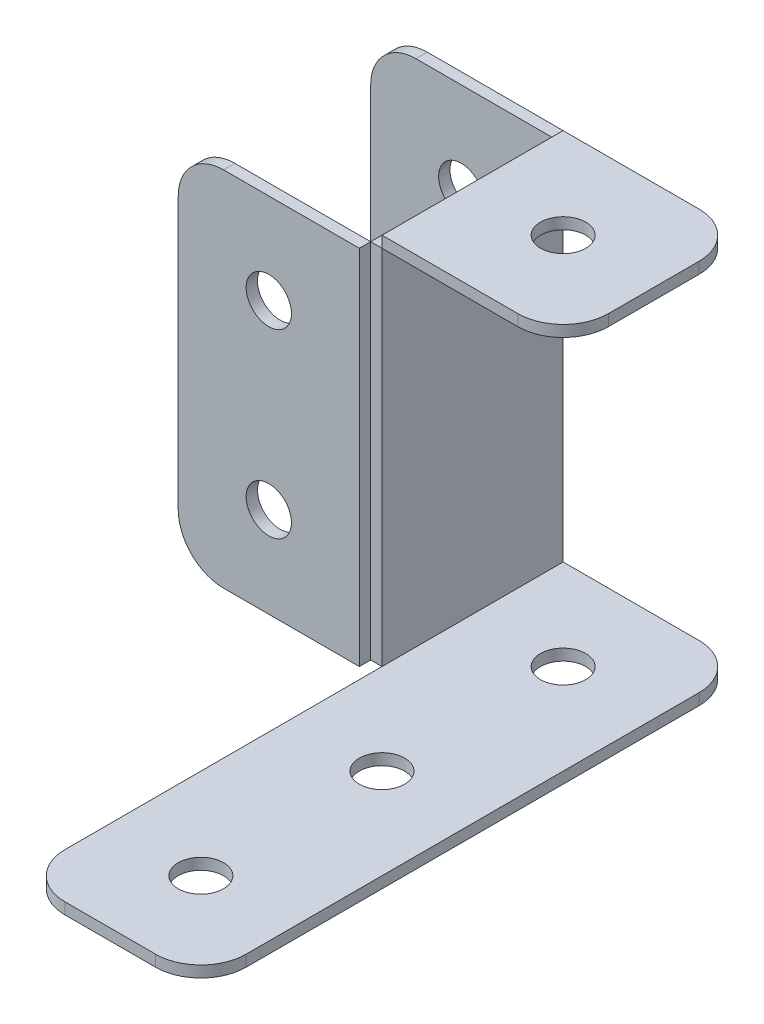
from build123d import *

# Parameters (mm, degrees)
SKETCH1_W           = 25.4
SKETCH1_H           = 50.8
SKETCH1_R           = 3.175
BOSS_EXTRUDE1_DEPTH = 1.5875
BOSS_EXTRUDE2_START = -25.4
SKETCH1_2_W         = 25.4
SKETCH1_2_H         = 50.8
SKETCH1_2_R         = 3.175
BOSS_EXTRUDE2_DEPTH = 1.5875
SKETCH3_W           = 25.4
SKETCH3_H           = 50.8
BOSS_EXTRUDE3_DEPTH = 1.5875
SKETCH4_R           = 3.175
BOSS_EXTRUDE4_DEPTH = 1.5875
SKETCH5_W           = 25.4
SKETCH5_H           = 25.4
SKETCH5_R           = 3.175
BOSS_EXTRUDE5_DEPTH = 1.5875
FILLET1_R           = 6.35
FILLET2_R           = 6.35
FILLET3_R           = 6.35
FILLET4_R           = 6.35


with BuildPart() as part:
    # Sketch1 → Boss-Extrude1 (new body)
    with BuildSketch(Plane.XY):
        with Locations((-12.7, 25.4)):
            Rectangle(SKETCH1_W, SKETCH1_H)
        with Locations((-12.7, 38.1)):
            Circle(SKETCH1_R, mode=Mode.SUBTRACT)
        with Locations((-12.7, 12.7)):
            Circle(SKETCH1_R, mode=Mode.SUBTRACT)
    extrude(amount=BOSS_EXTRUDE1_DEPTH)

    # Fillet3
    fillet3_edges = [part.edges().sort_by_distance(p)[0] for p in [
        (-25.4, 50.8, 0.79375),
        (-25.4, 0, 0.79375),
    ]]
    fillet(fillet3_edges, radius=FILLET3_R)


with BuildPart() as body_2:
    # Sketch1<2> → Boss-Extrude2 (new body)
    with BuildSketch(Plane.XY.offset(BOSS_EXTRUDE2_START)):
        with Locations((-12.7, 25.4)):
            Rectangle(SKETCH1_2_W, SKETCH1_2_H)
        with Locations((-12.7, 38.1)):
            Circle(SKETCH1_2_R, mode=Mode.SUBTRACT)
        with Locations((-12.7, 12.7)):
            Circle(SKETCH1_2_R, mode=Mode.SUBTRACT)
    extrude(amount=-BOSS_EXTRUDE2_DEPTH)

    # Fillet2
    fillet2_edges = [body_2.edges().sort_by_distance(p)[0] for p in [
        (-25.4, 0, -26.19375),
        (-25.4, 50.8, -26.19375),
    ]]
    fillet(fillet2_edges, radius=FILLET2_R)


with BuildPart() as body_3:
    # Sketch3 → Boss-Extrude3 (new body)
    with BuildSketch(Plane(origin=(0, 0, 0), x_dir=(0, 0, -1), z_dir=(1, 0, 0))):
        with Locations((12.7, 25.4)):
            Rectangle(SKETCH3_W, SKETCH3_H)
    extrude(amount=BOSS_EXTRUDE3_DEPTH)


with BuildPart() as body_4:
    # Sketch4 → Boss-Extrude4 (new body)
    with BuildSketch(Plane(origin=(0, 0, 0), x_dir=(1, 0, 0), z_dir=(0, 1, 0))):
        Polygon((1.5875, -50.8), (26.9875, -50.8), (26.9875, -25.4), (26.9875, 25.4), (1.5875, 25.4), (1.5875, 0), (1.5875, -25.4), align=None)
        with Locations((14.2875, 12.7)):
            Circle(SKETCH4_R, mode=Mode.SUBTRACT)
        with Locations((14.2875, -12.7)):
            Circle(SKETCH4_R, mode=Mode.SUBTRACT)
        with Locations((14.2875, -38.1)):
            Circle(SKETCH4_R, mode=Mode.SUBTRACT)
    extrude(amount=-BOSS_EXTRUDE4_DEPTH)

    # Fillet1
    fillet1_edges = [body_4.edges().sort_by_distance(p)[0] for p in [
        (26.9875, -0.79375, -25.4),
        (26.9875, -0.79375, 50.8),
        (1.5875, -0.79375, 50.8),
    ]]
    fillet(fillet1_edges, radius=FILLET1_R)


with BuildPart() as body_5:
    # Sketch5 → Boss-Extrude5 (new body)
    with BuildSketch(Plane(origin=(0, 50.8, 0), x_dir=(1, 0, 0), z_dir=(0, 1, 0))):
        with Locations((14.2875, 12.7)):
            Rectangle(SKETCH5_W, SKETCH5_H)
        with Locations((14.2875, 12.7)):
            Circle(SKETCH5_R, mode=Mode.SUBTRACT)
    extrude(amount=BOSS_EXTRUDE5_DEPTH)

    # Fillet4
    fillet4_edges = [body_5.edges().sort_by_distance(p)[0] for p in [
        (26.9875, 51.59375, -25.4),
        (26.9875, 51.59375, 0),
    ]]
    fillet(fillet4_edges, radius=FILLET4_R)


solid = Compound([part.part, body_2.part, body_3.part, body_4.part, body_5.part])
